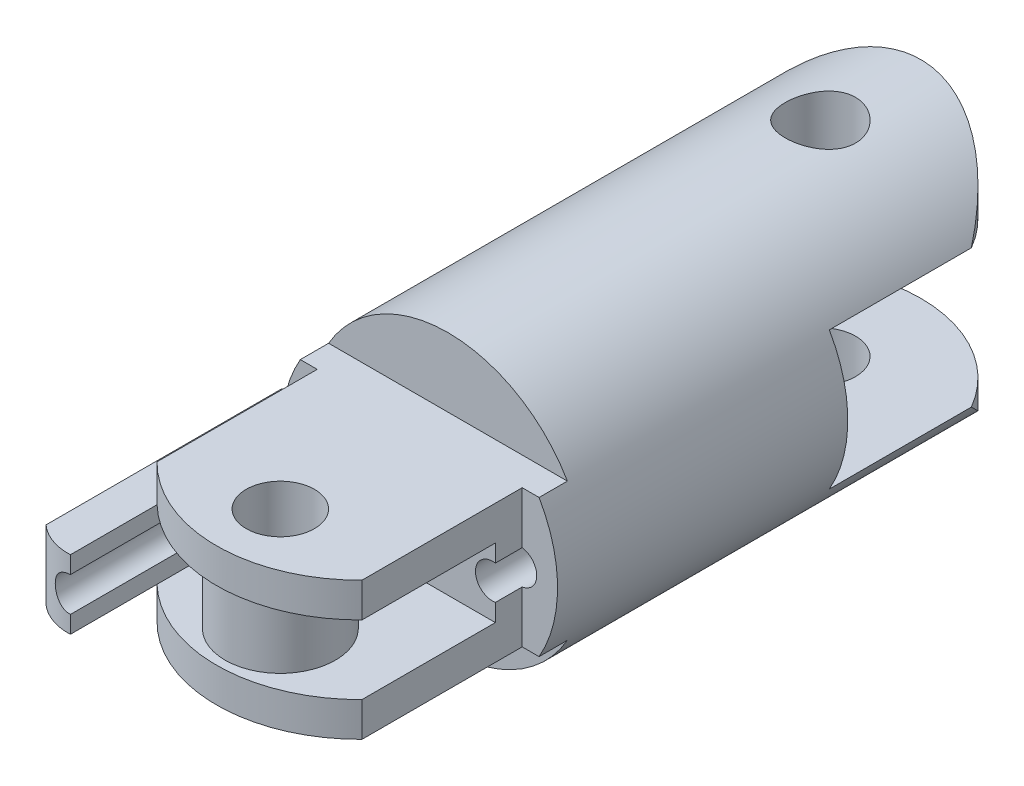
from build123d import *
from build123d.topology import SkipClean

# Parameters (mm, degrees)
SKETCH2_R                       = 10
PHALANGE_LENGTH_DEPTH           = 23
BOSS_EXTRUDE3_DEPTH             = 5
BOSS_EXTRUDE4_DEPTH             = 5
BOSS_EXTRUDE4_DEPTH_BACK        = 5
CUT_EXTRUDE2_START              = -15.3025
CUT_EXTRUDE2_DEPTH              = 15.3025
SKETCH7_R                       = 1.65
CUT_EXTRUDE3_DEPTH              = 10
CUT_EXTRUDE4_DEPTH              = 2.5
CUT_EXTRUDE4_DEPTH_BACK         = 2.5
CUT_EXTRUDE7_REACH              = 44.378
SKETCH4_R                       = 1.65
CUT_EXTRUDE7_DIRECTION_2_REACH  = 44.378
CUT_EXTRUDE_THIN1_START         = 23
CUT_EXTRUDE_THIN1_DEPTH         = 10.361670454
BOSS_EXTRUDE5_REACH             = 43.559
SKETCH9_R                       = 4
SKETCH9_R_2                     = 1.65
CUT_EXTRUDE8_REACH              = 42.83
SKETCH10_R                      = 1.25
CUT_EXTRUDE9_START              = -4
CUT_EXTRUDE9_DEPTH              = 4
CUT_EXTRUDE10_REACH             = 43.559
CUT_EXTRUDE10_DIRECTION_2_REACH = 43.559
CUT_EXTRUDE11_START             = -10
CUT_EXTRUDE11_OUTLINE_W         = 2.565773848
CUT_EXTRUDE11_OUTLINE_H         = 11.6166929
CUT_EXTRUDE11_DEPTH             = 10
BOSS_EXTRUDE7_REACH             = 41.207
CUT_EXTRUDE12_REACH             = 42.83
SKETCH10_2_R                    = 1.25
CUT_EXTRUDE12_DIRECTION_2_REACH = 42.83
SKETCH17_R                      = 1.25
SKETCH17_W                      = 2.42123439
SKETCH17_H                      = 5
CUT_EXTRUDE14_DEPTH             = 16.148519
SCALE1_SCALE                    = 0.666666667
CUT_EXTRUDE15_START             = -10
SKETCH18_R                      = 1.65
CUT_EXTRUDE15_DEPTH             = 13.333338
CUT_EXTRUDE16_START             = -3.333333
SKETCH19_R                      = 1.7
CUT_EXTRUDE16_DEPTH             = 13.333338


# Read off the part's stored shape, not the designer's step: Cut-Extrude-Thin1, Cut-Extrude11
with BuildPart() as part:
    # Sketch2 → Phalange Length (new body)
    with BuildSketch(Plane.XY):
        Circle(SKETCH2_R)
    extrude(amount=PHALANGE_LENGTH_DEPTH)

    # Sketch3 → Boss-Extrude3 (add)
    with BuildSketch(Plane(origin=(0, -10, 0), x_dir=(-1, 0, 0), z_dir=(0, -1, 0))):
        with BuildLine():
            Line((-10, 5.302499701), (-10, 0))
            Line((-10, 0), (10, 0))
            Line((10, 0), (10, 5.302499701))
            ThreePointArc((10, 5.302499701), (0, 15.302499701), (-10, 5.302499701))
        make_face()
    boss_extrude3 = extrude(amount=-BOSS_EXTRUDE3_DEPTH)

    # Mirror1: Boss-Extrude3 across plane
    add(boss_extrude3.mirror(Plane.ZX))

    # Sketch5 → Boss-Extrude4 (add, two sides: drawn at the far end of the back side and taken through both)
    with BuildSketch(Plane(origin=(0, 0, 0), x_dir=(1, 0, 0), z_dir=(0, 1, 0)).offset(-BOSS_EXTRUDE4_DEPTH_BACK)):
        with BuildLine():
            Line((-10, -28.783157911), (-10, -23))
            Line((-10, -23), (10, -23))
            Line((10, -23), (10, -28.783157911))
            ThreePointArc((10, -28.783157911), (0, -38.351984156), (-10, -28.783157911))
        make_face()
    extrude(amount=BOSS_EXTRUDE4_DEPTH + BOSS_EXTRUDE4_DEPTH_BACK)

    # Sketch6 → Cut-Extrude2 (cut)
    with SkipClean():  # the faces are left unmerged after this step: merging them gives an invalid solid
        with BuildSketch(Plane.XY.offset(CUT_EXTRUDE2_START)):
            with BuildLine():
                ThreePointArc((0, 10), (5, 8.660254038), (8.660254038, 5))
                Line((8.660254038, 5), (10, 5))
                Line((10, 5), (10, 10))
                Line((10, 10), (0, 10))
            make_face()
            with BuildLine():
                Line((10, -5), (8.660254038, -5))
                ThreePointArc((8.660254038, -5), (5, -8.660254038), (0, -10))
                Line((0, -10), (10, -10))
                Line((10, -10), (10, -5))
            make_face()
            with BuildLine():
                ThreePointArc((-8.660254038, 5), (-5, 8.660254038), (0, 10))
                Line((0, 10), (-10, 10))
                Line((-10, 10), (-10, 5))
                Line((-10, 5), (-8.660254038, 5))
            make_face()
            with BuildLine():
                Line((-10, -10), (0, -10))
                ThreePointArc((0, -10), (-5, -8.660254038), (-8.660254038, -5))
                Line((-8.660254038, -5), (-10, -5))
                Line((-10, -5), (-10, -10))
            make_face()
        extrude(amount=CUT_EXTRUDE2_DEPTH, mode=Mode.SUBTRACT)

    # Sketch7 → Cut-Extrude3 (cut)
    with SkipClean():  # the faces are left unmerged after this step: merging them gives an invalid solid
        with BuildSketch(Plane(origin=(0, 5, 0), x_dir=(1, 0, 0), z_dir=(0, 1, 0))):
            with Locations(Location((0, -31.161984156, 0), (0, 0, 270))):
                Circle(SKETCH7_R)
        extrude(amount=-CUT_EXTRUDE3_DEPTH, mode=Mode.SUBTRACT)

    # Sketch5<2> → Cut-Extrude4 (cut, two sides: drawn at the far end of the back side and taken through both)
    with BuildSketch(Plane(origin=(0, 0, 0), x_dir=(1, 0, 0), z_dir=(0, 1, 0)).offset(-CUT_EXTRUDE4_DEPTH_BACK)):
        with BuildLine():
            Line((-10, -28.783157911), (-10, -23))
            Line((-10, -23), (10, -23))
            Line((10, -23), (10, -28.783157911))
            ThreePointArc((10, -28.783157911), (0, -38.351984156), (-10, -28.783157911))
        make_face()
    extrude(amount=CUT_EXTRUDE4_DEPTH + CUT_EXTRUDE4_DEPTH_BACK, mode=Mode.SUBTRACT)

    # Sketch4 → Cut-Extrude7 (cut, up to next)
    with BuildSketch(Plane(origin=(0, -5, 0), x_dir=(1, 0, 0), z_dir=(0, 1, 0)), mode=Mode.PRIVATE) as cut_extrude7_sk1:
        with Locations(Location((0, 8.010159673, 0), (0, 0, 270))):
            Circle(SKETCH4_R)
    cut_extrude7_tool1 = extrude(cut_extrude7_sk1.sketch, amount=-CUT_EXTRUDE7_REACH, mode=Mode.PRIVATE) & part.part
    add(cut_extrude7_tool1.solids().sort_by_distance((0, -5, -8.01016))[0], mode=Mode.SUBTRACT)

    # Sketch4 → Cut-Extrude7 direction 2 (cut, up to next)
    with BuildSketch(Plane(origin=(0, -5, 0), x_dir=(1, 0, 0), z_dir=(0, 1, 0)), mode=Mode.PRIVATE) as cut_extrude7_direction_2_sk1:
        with Locations(Location((0, 8.010159673, 0), (0, 0, 270))):
            Circle(SKETCH4_R)
    cut_extrude7_direction_2_tool1 = extrude(cut_extrude7_direction_2_sk1.sketch, amount=CUT_EXTRUDE7_DIRECTION_2_REACH, mode=Mode.PRIVATE) & part.part
    add(cut_extrude7_direction_2_tool1.solids().sort_by_distance((0, -5, -8.01016))[0], mode=Mode.SUBTRACT)

    # Cut-Extrude-Thin1 outline → Cut-Extrude-Thin1 (cut)
    with SkipClean():  # the faces are left unmerged after this step: merging them gives an invalid solid
        with BuildSketch(Plane.XY.offset(CUT_EXTRUDE_THIN1_START)):
            with BuildLine():
                ThreePointArc((8.660254038, 5), (9.256147934, 3.78466979), (9.682458366, 2.5))
                Line((9.682458366, 2.5), (10, 2.5))
                Line((10, 2.5), (10, 5))
                Line((10, 5), (8.660254038, 5))
            make_face()
            with BuildLine():
                Line((10, -2.5), (9.682458366, -2.5))
                ThreePointArc((9.682458366, -2.5), (9.256147934, -3.78466979), (8.660254038, -5))
                Line((8.660254038, -5), (10, -5))
                Line((10, -5), (10, -2.5))
            make_face()
            with BuildLine():
                Line((-10, 2.5), (-9.682458366, 2.5))
                ThreePointArc((-9.682458366, 2.5), (-9.256147934, 3.78466979), (-8.660254038, 5))
                Line((-8.660254038, 5), (-10, 5))
                Line((-10, 5), (-10, 2.5))
            make_face()
            with BuildLine():
                ThreePointArc((-8.660254038, -5), (-9.256147934, -3.78466979), (-9.682458366, -2.5))
                Line((-9.682458366, -2.5), (-10, -2.5))
                Line((-10, -2.5), (-10, -5))
                Line((-10, -5), (-8.660254038, -5))
            make_face()
        extrude(amount=CUT_EXTRUDE_THIN1_DEPTH, mode=Mode.SUBTRACT)

    # Sketch9 → Boss-Extrude5 (add, up to next)
    with BuildSketch(Plane.XZ.offset(-2.5), mode=Mode.PRIVATE) as boss_extrude5_sk1:
        with Locations(Location((0, 31.161984156, 0), (0, 0, 90))):
            Circle(SKETCH9_R)
        with Locations(Location((0, 31.161984156, 0), (0, 0, 90))):
            Circle(SKETCH9_R_2, mode=Mode.SUBTRACT)
    boss_extrude5_tool1 = extrude(boss_extrude5_sk1.sketch, amount=BOSS_EXTRUDE5_REACH, mode=Mode.PRIVATE) - part.part
    add(boss_extrude5_tool1.solids().sort_by_distance((0, 2.5, 27.275121))[0])

    # Sketch10 → Cut-Extrude8 (cut, up to next)
    with BuildSketch(Plane.XY.offset(23), mode=Mode.PRIVATE) as cut_extrude8_sk1:
        with Locations((7.239961745, 0)):
            Circle(SKETCH10_R)
    cut_extrude8_tool1 = extrude(cut_extrude8_sk1.sketch, amount=-CUT_EXTRUDE8_REACH, mode=Mode.PRIVATE) & part.part
    # Sketch10 → Cut-Extrude8 (cut, up to next)
    with BuildSketch(Plane.XY.offset(23), mode=Mode.PRIVATE) as cut_extrude8_sk2:
        with Locations((-7.239961745, 0)):
            Circle(SKETCH10_R)
    cut_extrude8_tool2 = extrude(cut_extrude8_sk2.sketch, amount=-CUT_EXTRUDE8_REACH, mode=Mode.PRIVATE) & part.part
    add(cut_extrude8_tool1.solids().sort_by_distance((7.239962, 0, 23))[0], mode=Mode.SUBTRACT)
    add(cut_extrude8_tool2.solids().sort_by_distance((-7.239962, 0, 23))[0], mode=Mode.SUBTRACT)

    # Sketch11 → Cut-Extrude9 (cut)
    with SkipClean():  # the faces are left unmerged after this step: merging them gives an invalid solid
        with BuildSketch(Plane.XY.offset(23).offset(CUT_EXTRUDE9_START)):
            with BuildLine():
                ThreePointArc((8.660254038, 5), (0, 10), (-8.660254038, 5))
                Line((-8.660254038, 5), (8.660254038, 5))
            make_face()
            with BuildLine():
                Line((8.660254038, -5), (-8.660254038, -5))
                ThreePointArc((-8.660254038, -5), (0, -10), (8.660254038, -5))
            make_face()
        extrude(amount=CUT_EXTRUDE9_DEPTH, mode=Mode.SUBTRACT)

    # Sketch12 → Cut-Extrude10 (cut, up to next)
    with BuildSketch(Plane.XZ.offset(-2.5), mode=Mode.PRIVATE) as cut_extrude10_sk1:
        with BuildLine():
            Line((-10.033719202, 38.351984156), (-10.033719202, 31.164892021))
            Line((-10.033719202, 31.164892021), (-8.660254038, 31.164892021))
            ThreePointArc((-8.660254038, 31.164892021), (0, 35.790740593), (8.660254038, 31.164892021))
            Line((8.660254038, 31.164892021), (10.033719202, 31.164892021))
            Line((10.033719202, 31.164892021), (10.033719202, 38.351984156))
            Line((10.033719202, 38.351984156), (-10.033719202, 38.351984156))
        make_face()
    cut_extrude10_tool1 = extrude(cut_extrude10_sk1.sketch, amount=CUT_EXTRUDE10_REACH, mode=Mode.PRIVATE) & part.part
    add(cut_extrude10_tool1.solids().sort_by_distance((0, 2.5, 35.850279))[0], mode=Mode.SUBTRACT)

    # Sketch12 → Cut-Extrude10 direction 2 (cut, up to next)
    with BuildSketch(Plane.XZ.offset(-2.5), mode=Mode.PRIVATE) as cut_extrude10_direction_2_sk1:
        with BuildLine():
            Line((-10.033719202, 38.351984156), (-10.033719202, 31.164892021))
            Line((-10.033719202, 31.164892021), (-8.660254038, 31.164892021))
            ThreePointArc((-8.660254038, 31.164892021), (0, 35.790740593), (8.660254038, 31.164892021))
            Line((8.660254038, 31.164892021), (10.033719202, 31.164892021))
            Line((10.033719202, 31.164892021), (10.033719202, 38.351984156))
            Line((10.033719202, 38.351984156), (-10.033719202, 38.351984156))
        make_face()
    cut_extrude10_direction_2_tool1 = extrude(cut_extrude10_direction_2_sk1.sketch, amount=-CUT_EXTRUDE10_DIRECTION_2_REACH, mode=Mode.PRIVATE) & part.part
    add(cut_extrude10_direction_2_tool1.solids().sort_by_distance((0, 2.5, 35.850279))[0], mode=Mode.SUBTRACT)

    # Cut-Extrude11 outline → Cut-Extrude11 (cut)
    with BuildSketch(Plane.XZ.offset(5).offset(CUT_EXTRUDE11_START)):
        with Locations((-8.717113076, 26.860571369)):
            Rectangle(CUT_EXTRUDE11_OUTLINE_W, CUT_EXTRUDE11_OUTLINE_H)
        with Locations((8.717113076, 26.860571369)):
            Rectangle(CUT_EXTRUDE11_OUTLINE_W, CUT_EXTRUDE11_OUTLINE_H)
    extrude(amount=CUT_EXTRUDE11_DEPTH, mode=Mode.SUBTRACT)

    # Boss-Extrude7: up to this face of the body (flat: up to its plane)
    boss_extrude7_end = Plane(part.part.faces().sort_by_distance((0, 2.5, 23.196174341))[0])
    # Sketch16 → Boss-Extrude7 (add, up to the picked face)
    with BuildSketch(Plane(origin=(0, -2.5, 0), x_dir=(1, 0, 0), z_dir=(0, 1, 0)), mode=Mode.PRIVATE) as boss_extrude7_sk1:
        with BuildLine():
            Line((-4.818727355, -21.052224919), (-7.434226152, -21.052224919))
            Line((-7.434226152, -21.052224919), (-10, -21.052224919))
            Line((-10, -21.052224919), (-10, -38.158561033))
            ThreePointArc((-10, -38.158561033), (-8.808295471, -38.890817912), (-7.43422564, -39.152145139))
            ThreePointArc((-7.43422564, -39.152145139), (-6.033645007, -38.899721533), (-4.818727355, -38.158561033))
            Line((-4.818727355, -38.158561033), (-4.818727355, -34.609527951))
            ThreePointArc((-4.818727355, -34.609527951), (-6.204248493, -33.742230104), (-7.437080645, -32.668917819))
            Line((-7.437080645, -32.668917819), (-7.434226152, -32.668917819))
            Line((-7.434226152, -32.668917819), (-7.434226152, -23))
            Line((-7.434226152, -23), (-4.818727355, -23))
            Line((-4.818727355, -23), (-4.818727355, -21.052224919))
        make_face()
    boss_extrude7_tool1 = split(extrude(boss_extrude7_sk1.sketch, amount=BOSS_EXTRUDE7_REACH, mode=Mode.PRIVATE), bisect_by=boss_extrude7_end, keep=Keep.BOTH, mode=Mode.PRIVATE)
    # Sketch16 → Boss-Extrude7 (add, up to the picked face)
    with BuildSketch(Plane(origin=(0, -2.5, 0), x_dir=(1, 0, 0), z_dir=(0, 1, 0)), mode=Mode.PRIVATE) as boss_extrude7_sk2:
        with BuildLine():
            Line((-4.818727355, -34.609527951), (-4.818727355, -23))
            Line((-4.818727355, -23), (-7.434226152, -23))
            Line((-7.434226152, -23), (-7.434226152, -32.668917819))
            Line((-7.434226152, -32.668917819), (-7.437080645, -32.668917819))
            ThreePointArc((-7.437080645, -32.668917819), (-6.204248493, -33.742230104), (-4.818727355, -34.609527951))
        make_face()
    boss_extrude7_tool2 = split(extrude(boss_extrude7_sk2.sketch, amount=BOSS_EXTRUDE7_REACH, mode=Mode.PRIVATE), bisect_by=boss_extrude7_end, keep=Keep.BOTH, mode=Mode.PRIVATE)
    add(boss_extrude7_tool1.solids().sort_by(Axis((-7.989429, -2.5, 30.633344), (0, 1, 0)))[0])
    add(boss_extrude7_tool2.solids().sort_by(Axis((-6.08748, -2.5, 28.3879), (0, 1, 0)))[0])

    # Sketch10<2> → Cut-Extrude12 (cut, up to next)
    with BuildSketch(Plane.XY.offset(23), mode=Mode.PRIVATE) as cut_extrude12_sk1:
        with Locations((-7.239961745, 0)):
            Circle(SKETCH10_2_R)
    cut_extrude12_tool1 = extrude(cut_extrude12_sk1.sketch, amount=CUT_EXTRUDE12_REACH, mode=Mode.PRIVATE) & part.part
    add(cut_extrude12_tool1.solids().sort_by_distance((-7.239962, 0, 23))[0], mode=Mode.SUBTRACT)

    # Sketch10<2> → Cut-Extrude12 direction 2 (cut, up to next)
    with BuildSketch(Plane.XY.offset(23), mode=Mode.PRIVATE) as cut_extrude12_direction_2_sk1:
        with Locations((-7.239961745, 0)):
            Circle(SKETCH10_2_R)
    cut_extrude12_direction_2_tool1 = extrude(cut_extrude12_direction_2_sk1.sketch, amount=-CUT_EXTRUDE12_DIRECTION_2_REACH, mode=Mode.PRIVATE) & part.part
    add(cut_extrude12_direction_2_tool1.solids().sort_by_distance((-7.239962, 0, 23))[0], mode=Mode.SUBTRACT)

    # Sketch17 → Cut-Extrude14 (cut)
    with SkipClean():  # the faces are left unmerged after this step: merging them gives an invalid solid
        with BuildSketch(Plane.XY.offset(23)):
            with Locations((-7.239961745, 0)):
                Circle(SKETCH17_R)
            with Locations((-6.02934455, 0)):
                Rectangle(SKETCH17_W, SKETCH17_H)
        extrude(amount=CUT_EXTRUDE14_DEPTH, mode=Mode.SUBTRACT)


with BuildPart() as part_1:
    # Scale1: scaled about (-0.18837751, -1.72e-07, 9.934517088)
    add(part.part.scale(SCALE1_SCALE).moved(Location((-0.062792503, -5.7e-08, 3.311505696))))

    # Sketch18 → Cut-Extrude15 (cut)
    with BuildSketch(Plane(origin=(0, 3.3333287, 0), x_dir=(1, 0, 0), z_dir=(0, 1, 0)).offset(CUT_EXTRUDE15_START)):
        with Locations(Location((-0.062801677, -24.086327732, 0), (0, 0, 270))):
            Circle(SKETCH18_R)
    extrude(amount=CUT_EXTRUDE15_DEPTH, mode=Mode.SUBTRACT)

    # Sketch19 → Cut-Extrude16 (cut)
    with BuildSketch(Plane(origin=(0, -3.333337967, 0), x_dir=(1, 0, 0), z_dir=(0, 1, 0)).offset(CUT_EXTRUDE16_START)):
        with Locations(Location((-0.062801677, 2.02843482, 0), (0, 0, 90))):
            Circle(SKETCH19_R)
    extrude(amount=CUT_EXTRUDE16_DEPTH, mode=Mode.SUBTRACT)


solid = part_1.part
